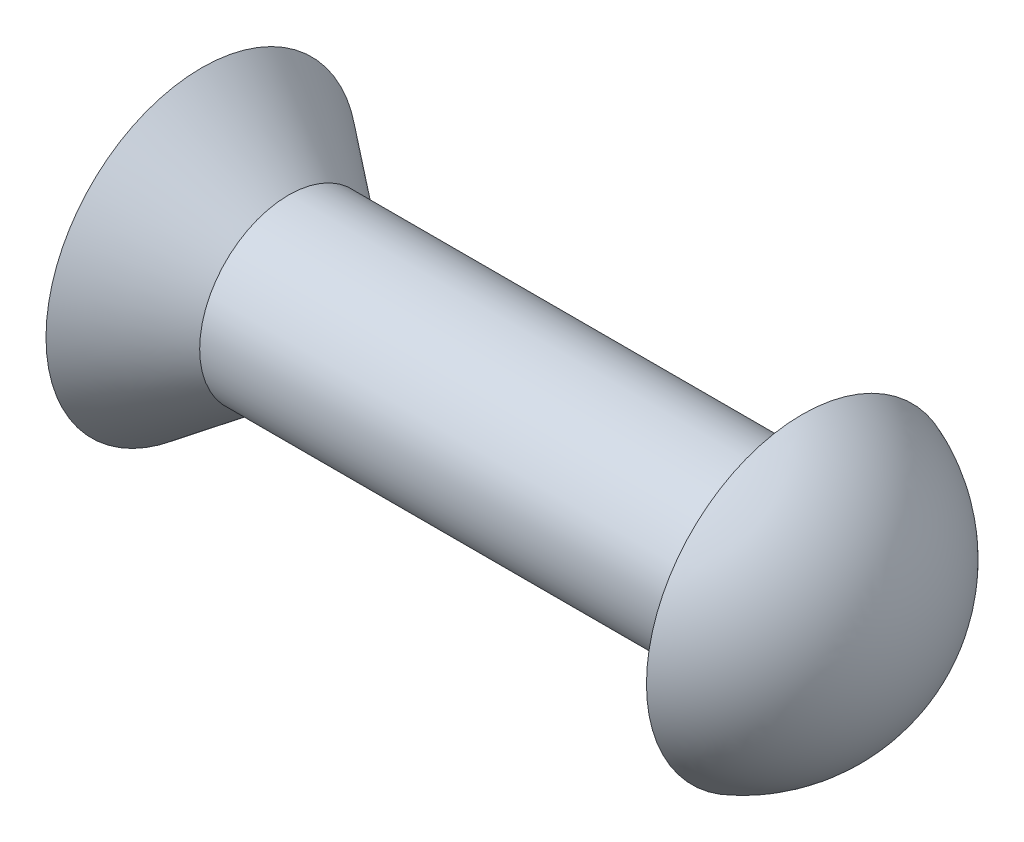
from build123d import *


with BuildPart() as part:
    # Sketch1 → Base-Revolve (revolve)
    with BuildSketch(Plane.XY):
        Polygon((-27, 0), (0, 0), (0, 4), (-23.090323881, 4), (-27, 7), align=None)
    revolve(axis=Axis((-34, 0, 0), (1, 0, 0)))

    # Sketch2 → HeadTypeA (revolve)
    with BuildSketch(Plane.XY):
        with BuildLine():
            Line((0, 0), (4.8, 0))
            ThreePointArc((4.8, 0), (3.485466933, 4.244320183), (0, 7))
            Line((0, 7), (0, 0))
        make_face()
    revolve(axis=Axis((-32, 0, 0), (1, 0, 0)))


solid = part.part
